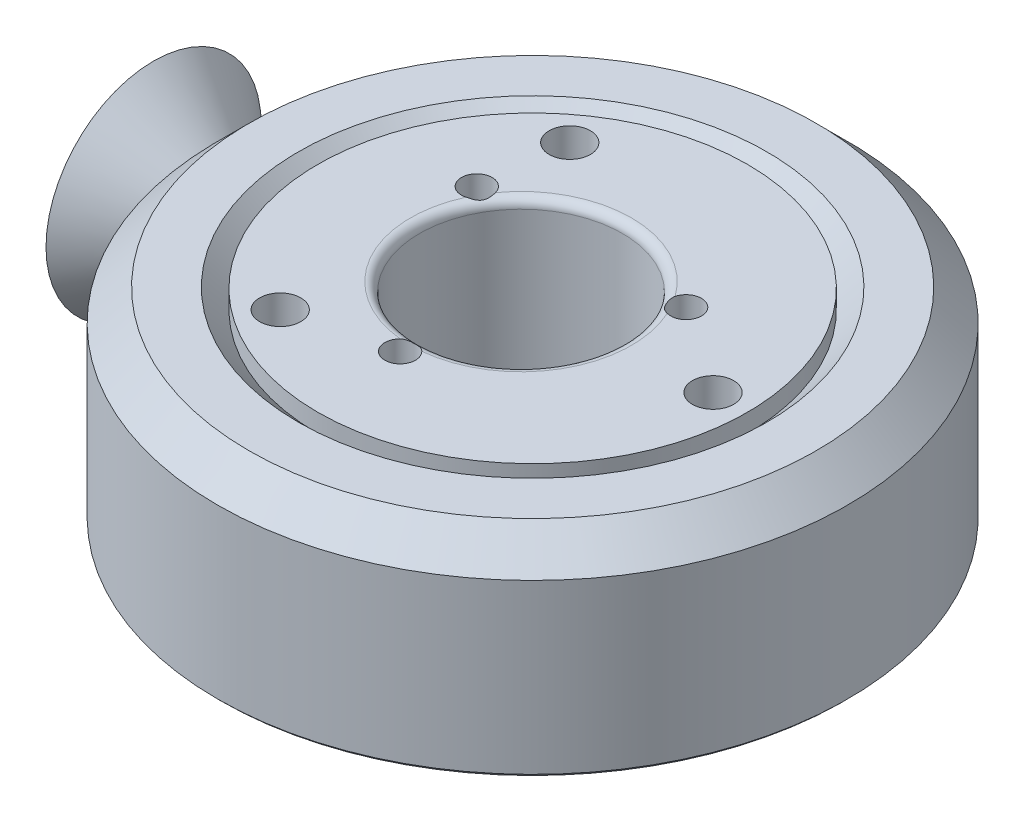
from build123d import *

# Parameters (mm, degrees)
SKETCH1_R               = 34.925
SKETCH1_R_2             = 23.8125
BOSS_EXTRUDE1_DEPTH     = 11.2395
CHAMFER1_SIZE           = 2.159
CHAMFER2_SIZE           = 3.4798000000000004
CHAMFER3_SIZE           = 0.381
CHAMFER4_SIZE           = 1.27
SKETCH3_R               = 23.8125
BOSS_EXTRUDE2_DEPTH     = 11.112499999999999
CUT_EXTRUDE1_DEPTH      = 60.304470691571126
CUT_EXTRUDE1_DEPTH_BACK = 60.304470691571126
SKETCH4_R               = 11.25000000000001
CUT_EXTRUDE3_DEPTH      = 6.35
SKETCH12_R              = 27.8125
SKETCH12_R_2            = 11.25000000000001
BOSS_EXTRUDE5_DEPTH     = 2
SKETCH13_R              = 15.25000000000001
SKETCH13_R_2            = 11.25000000000001
BOSS_EXTRUDE6_DEPTH     = 7
SKETCH14_R              = 17.250000000000007
SKETCH14_R_2            = 11.25000000000001
BOSS_EXTRUDE7_DEPTH     = 2
SKETCH15_R              = 2.286
SKETCH15_R_2            = 2.285999999999998
CUT_EXTRUDE5_DEPTH      = 61.10923925992925
SKETCH16_R              = 1.6999999999999995
SKETCH16_R_2            = 1.7000000000000004
SKETCH16_R_3            = 1.699999999999998
CUT_EXTRUDE6_DEPTH      = 65.37835386375936
CHAMFER5_SIZE           = 2
FILLET1_R               = 1


with BuildPart() as part:
    # Sketch1 → Boss-Extrude1 (new, symmetric)
    with BuildSketch(Plane(origin=(0, 0, 0), x_dir=(1, 0, 0), z_dir=(0, 1, 0))):
        with Locations(Location((0, 0, 0), (0, 0, 270))):
            Circle(SKETCH1_R)
        with Locations(Location((0, 0, 0), (0, 0, 270))):
            Circle(SKETCH1_R_2, mode=Mode.SUBTRACT)
    extrude(amount=BOSS_EXTRUDE1_DEPTH, both=True)

    # Chamfer1
    chamfer1_edges = [part.edges().sort_by_distance(p)[0] for p in [
        (7.29e-15, -11.2395, -23.8125),
        (7.29e-15, 11.2395, -23.8125),
    ]]
    chamfer(chamfer1_edges, length=CHAMFER1_SIZE)

    # Chamfer2
    chamfer2_edges = [part.edges().sort_by_distance(p)[0] for p in [
        (1.069e-14, 11.2395, -34.925),
    ]]
    chamfer(chamfer2_edges, length=CHAMFER2_SIZE)

    # Chamfer3
    chamfer3_edges = [part.edges().sort_by_distance(p)[0] for p in [
        (1.069e-14, -11.2395, -34.925),
    ]]
    chamfer(chamfer3_edges, length=CHAMFER3_SIZE)

    # Sketch2 → Revolve1 (revolve)
    with BuildSketch(Plane(origin=(0, 0, 0), x_dir=(1, 0, 0), z_dir=(0, 1, 0)), mode=Mode.PRIVATE) as revolve1_sk:
        Polygon((-42.03699999999999, 11.9126), (-42.03699999999999, 0), (-17.11959999999999, 0), (-17.11959999999999, 5.369303693380148), (-34.5097986497785, 5.369303693380146), align=None)
    revolve(revolve1_sk.sketch.rotate(Axis((-42.03699999999999, 0, 0), (1, 0, 0)), 180), axis=Axis((-42.03699999999999, 0, 0), (1, 0, 0)))

    # Chamfer4
    chamfer4_edges = [part.edges().sort_by_distance(p)[0] for p in [
        (-17.11959999999999, 1.07e-15, -5.369303693380148),
    ]]
    chamfer(chamfer4_edges, length=CHAMFER4_SIZE)

    # Sketch6 → Cut-Extrude3 (cut)
    with BuildSketch(Plane.ZY.offset(42.03699999999999)):
        Polygon((-4.619379503786196, 1.7e-15), (-2.3096897518931003, -4.000500000000001), (2.3096897518930977, -4.000499999999999), (4.619379503786196, 2.98e-15), (2.3096897518931, 4.000500000000001), (-2.3096897518930986, 4.0005000000000015), align=None)
    extrude(amount=-CUT_EXTRUDE3_DEPTH, mode=Mode.SUBTRACT)


with BuildPart() as body_2:
    # Sketch3 → Boss-Extrude2 (new, symmetric)
    with BuildSketch(Plane(origin=(0, 0, 0), x_dir=(1, 0, 0), z_dir=(0, 1, 0))):
        with Locations(Location((0, 0, 0), (0, 0, 270))):
            Circle(SKETCH3_R)
    extrude(amount=BOSS_EXTRUDE2_DEPTH, both=True)

    # Sketch4 → Cut-Extrude1 (cut, two sides: drawn at the far end of the back side and taken through both)
    with BuildSketch(Plane(origin=(0, 11.112499999999999, 0), x_dir=(1, 0, 0), z_dir=(0, 1, 0)).offset(-CUT_EXTRUDE1_DEPTH_BACK)):
        with Locations(Location((-1.28929384, 0, 0), (0, 0, 270))):
            Circle(SKETCH4_R)
    extrude(amount=CUT_EXTRUDE1_DEPTH + CUT_EXTRUDE1_DEPTH_BACK, mode=Mode.SUBTRACT)

    # Sketch9 → Cut-Revolve1 (revolve, cut)
    with BuildSketch(Plane.XY):
        Polygon((-23.8125, 6.603999999999999), (-15.8125, 6.603999999999999), (-15.8125, 7e-17), (-23.8125, -8.7e-16), align=None)
    revolve(axis=Axis((-15.8125, 7e-17, 0), (-1, -1.2e-16, 0)), mode=Mode.SUBTRACT)

    # Sketch12 → Boss-Extrude5 (add)
    with BuildSketch(Plane.XZ.offset(11.112499999999999)):
        with Locations(Location((0, 0, 0), (0, 0, 270))):
            Circle(SKETCH12_R)
        with Locations(Location((-1.28929384, 0, 0), (0, 0, 90))):
            Circle(SKETCH12_R_2, mode=Mode.SUBTRACT)
    extrude(amount=BOSS_EXTRUDE5_DEPTH)

    # Sketch13 → Boss-Extrude6 (add)
    with BuildSketch(Plane.XZ.offset(13.112499999999999)):
        with Locations(Location((-1.28929384, 0, 0), (0, 0, 270))):
            Circle(SKETCH13_R)
        with Locations(Location((-1.28929384, 0, 0), (0, 0, 90))):
            Circle(SKETCH13_R_2, mode=Mode.SUBTRACT)
    extrude(amount=BOSS_EXTRUDE6_DEPTH)

    # Sketch14 → Boss-Extrude7 (add)
    with BuildSketch(Plane.XZ.offset(20.112499999999997)):
        with Locations(Location((-1.28929384, 0, 0), (0, 0, 270))):
            Circle(SKETCH14_R)
        with Locations(Location((-1.28929384, 0, 0), (0, 0, 90))):
            Circle(SKETCH14_R_2, mode=Mode.SUBTRACT)
    extrude(amount=BOSS_EXTRUDE7_DEPTH)

    # Sketch15 → Cut-Extrude5 (cut, through all)
    with BuildSketch(Plane.XZ.offset(13.112499999999999)):
        with Locations(Location((-11.933940759999999, 16.04933200905292, 0), (0, 0, 270))):
            Circle(SKETCH15_R)
        with Locations(Location((20, 0, 0), (0, 0, 270))):
            Circle(SKETCH15_R_2)
        with Locations(Location((-11.93394076, -16.04933200905292, 0), (0, 0, 270))):
            Circle(SKETCH15_R)
    extrude(amount=-CUT_EXTRUDE5_DEPTH, mode=Mode.SUBTRACT)

    # Sketch16 → Cut-Extrude6 (cut, through all)
    with BuildSketch(Plane.XZ.offset(22.1125)):
        with Locations(Location((-12.894034250711446, -6.700000000000057, 0), (0, 0, 270))):
            Circle(SKETCH16_R)
        with Locations(Location((-1.2892938399999998, 13.399999999999999, 0), (0, 0, 270))):
            Circle(SKETCH16_R_2)
        with Locations(Location((10.315446570711494, -6.699999999999969, 0), (0, 0, 270))):
            Circle(SKETCH16_R_3)
    extrude(amount=-CUT_EXTRUDE6_DEPTH, mode=Mode.SUBTRACT)

    # Sketch17 → Revolve2 (revolve)
    with BuildSketch(Plane.XY, mode=Mode.PRIVATE) as revolve2_sk:
        Polygon((-12.53929384000001, -16.1125), (-12.539293840000006, -8.2605), (-11.125080277626914, -9.674713562373098), (-11.125080277626914, -14.698286437626908), align=None)
    revolve(revolve2_sk.sketch.rotate(Axis((-1.28929384, -11.112499999999999, 0), (0, 1, 0)), 270), axis=Axis((-1.28929384, -11.112499999999999, 0), (0, 1, 0)))

    # Chamfer5
    # the kernel refuses this chamfer: 2 mm, written as the material it takes off along each edge
    with BuildSketch(Plane(origin=(-11.933940759999999, -13.112499999999999, 16.04933200905292), x_dir=(0, 0, -1), z_dir=(-1, 0, 0))) as chamfer5_piece_1_section:
        Polygon((2.2859999999999996 + CHAMFER5_SIZE, 0), (2.2859999999999996, -CHAMFER5_SIZE), (2.2859999999999996, 0), align=None)
    chamfer5_piece_1 = revolve(axis=Axis((-11.933940759999999, -13.112499999999999, 16.04933200905292), (0, -1, 0)), mode=Mode.PRIVATE)
    chamfer5_piece_1 = chamfer5_piece_1 - Plane(origin=(-1.28929384, -12.13680810248549, 0), x_dir=(-1.8e-16, 0, -1), z_dir=(0, 1, 0)) * Cylinder(15.25000000000001, 18, mode=Mode.PRIVATE)
    add(chamfer5_piece_1, mode=Mode.SUBTRACT)
    with BuildSketch(Plane(origin=(20, -13.112499999999999, 0), x_dir=(0, 0, -1), z_dir=(-1, 0, 0))) as chamfer5_piece_2:
        Polygon((2.285999999999998, -CHAMFER5_SIZE), (2.285999999999998 + CHAMFER5_SIZE, 0), (2.285999999999998, 0), align=None)
    revolve(axis=Axis((20, -13.112499999999999, 0), (0, -1, 0)), mode=Mode.SUBTRACT)
    with BuildSketch(Plane(origin=(-11.93394076, -13.112499999999999, -16.04933200905292), x_dir=(0, 0, -1), z_dir=(-1, 0, 0))) as chamfer5_piece_3_section:
        Polygon((2.2860000000000014 + CHAMFER5_SIZE, 0), (2.2860000000000014, -CHAMFER5_SIZE), (2.2860000000000014, 0), align=None)
    chamfer5_piece_3 = revolve(axis=Axis((-11.93394076, -13.112499999999999, -16.04933200905292), (0, -1, 0)), mode=Mode.PRIVATE)
    chamfer5_piece_3 = chamfer5_piece_3 - Plane(origin=(-1.28929384, -12.13680810440251, 0), x_dir=(-1.8e-16, 0, -1), z_dir=(0, 1, 0)) * Cylinder(15.25000000000001, 18, mode=Mode.PRIVATE)
    add(chamfer5_piece_3, mode=Mode.SUBTRACT)
    with BuildSketch(Plane(origin=(-12.894034250711446, -22.1125, -6.700000000000057), x_dir=(0, 0, -1), z_dir=(-1, 0, 0))) as chamfer5_piece_4:
        Polygon((1.7000000000000002 + CHAMFER5_SIZE, -3.55e-15), (1.7000000000000002, -CHAMFER5_SIZE), (1.7000000000000002, 0), align=None)
    revolve(axis=Axis((-12.894034250711446, -22.1125, -6.700000000000057), (0, -1, 0)), mode=Mode.SUBTRACT)
    with BuildSketch(Plane(origin=(-1.2892938399999998, -22.1125, 13.399999999999999), x_dir=(-1.3e-16, 0, -1), z_dir=(-1, 0, 1.3e-16))) as chamfer5_piece_5:
        Polygon((1.700000000000001 + CHAMFER5_SIZE, -3.55e-15), (1.700000000000001, -CHAMFER5_SIZE), (1.700000000000001, 0), align=None)
    revolve(axis=Axis((-1.2892938399999998, -22.1125, 13.399999999999999), (0, -1, 0)), mode=Mode.SUBTRACT)
    with BuildSketch(Plane(origin=(10.315446570711494, -22.1125, -6.699999999999969), x_dir=(0, 0, -1), z_dir=(-1, 0, 0))) as chamfer5_piece_6:
        Polygon((1.6999999999999975 + CHAMFER5_SIZE, -3.55e-15), (1.6999999999999975, -CHAMFER5_SIZE), (1.6999999999999975, 0), align=None)
    revolve(axis=Axis((10.315446570711494, -22.1125, -6.699999999999969), (0, -1, 0)), mode=Mode.SUBTRACT)

    # Fillet1
    # the kernel refuses this fillet: 1 mm, written as the material it takes off along each edge
    with BuildSketch(Plane(origin=(-1.28929384, 11.112499999999999, 0), x_dir=(-1.8e-16, 0, 1), z_dir=(-1, 0, -1.8e-16))) as fillet1_piece_1:
        with BuildLine():
            CenterArc((11.25000000000001 + FILLET1_R, -FILLET1_R), FILLET1_R, 90, 90)
            Line((11.25000000000001, -FILLET1_R), (11.25000000000001, 0))
            Line((11.25000000000001, 0), (11.25000000000001 + FILLET1_R, 0))
        make_face()
    revolve(axis=Axis((-1.28929384, 11.112499999999999, 0), (0, 1, 0)), mode=Mode.SUBTRACT)
    with BuildSketch(Plane(origin=(-1.28929384, -22.112499999999997, 0), x_dir=(-0.8540076310852184, 0, -0.520260479037389), z_dir=(-0.520260479037389, 0, 0.8540076310852184))) as fillet1_piece_2:
        with BuildLine():
            CenterArc((11.25000000000001 + FILLET1_R, -FILLET1_R), FILLET1_R, 90, 90)
            Line((11.25000000000001 + FILLET1_R, 0), (11.25000000000001, 0))
            Line((11.25000000000001, 0), (11.25000000000001, -FILLET1_R))
        make_face()
    revolve(axis=Axis((-1.28929384, -22.112499999999997, 0), (0, -1, 0)), revolution_arc=117.30054892498238, mode=Mode.SUBTRACT)
    with BuildSketch(Plane(origin=(-1.28929384, -22.112499999999997, 0), x_dir=(0.8775626069740258, 0, -0.47946206402691705), z_dir=(-0.47946206402691705, 0, -0.8775626069740258))) as fillet1_piece_3:
        with BuildLine():
            CenterArc((11.25000000000001 + FILLET1_R, -FILLET1_R), FILLET1_R, 90, 90)
            Line((11.25000000000001 + FILLET1_R, 0), (11.25000000000001, 0))
            Line((11.25000000000001, 0), (11.25000000000001, -FILLET1_R))
        make_face()
    revolve(axis=Axis((-1.28929384, -22.112499999999997, 0), (0, -1, 0)), revolution_arc=117.3005489249881, mode=Mode.SUBTRACT)
    with BuildSketch(Plane(origin=(-1.28929384, -22.112499999999997, 0), x_dir=(-0.023554975888780104, 0, 0.9997225430642639), z_dir=(0.9997225430642639, 0, 0.023554975888780104))) as fillet1_piece_4:
        with BuildLine():
            CenterArc((11.25000000000001 + FILLET1_R, -FILLET1_R), FILLET1_R, 90, 90)
            Line((11.25000000000001 + FILLET1_R, 0), (11.25000000000001, 0))
            Line((11.25000000000001, 0), (11.25000000000001, -FILLET1_R))
        make_face()
    revolve(axis=Axis((-1.28929384, -22.112499999999997, 0), (0, -1, 0)), revolution_arc=117.30054892498829, mode=Mode.SUBTRACT)


with BuildPart() as body_3:
    # Split1: the piece on the far side of the plane
    add(body_2.part)
    split(bisect_by=Plane(origin=(0, -13.112499999999999, 0), x_dir=(0, 0, -1), z_dir=(0, -1, 0)), keep=Keep.BOTTOM)


with BuildPart() as body_2_1:
    add(body_2.part)

    # Split1
    split(bisect_by=Plane(origin=(0, -13.112499999999999, 0), x_dir=(0, 0, -1), z_dir=(0, -1, 0)), keep=Keep.TOP)


solid = Compound([part.part, body_3.part, body_2_1.part])
